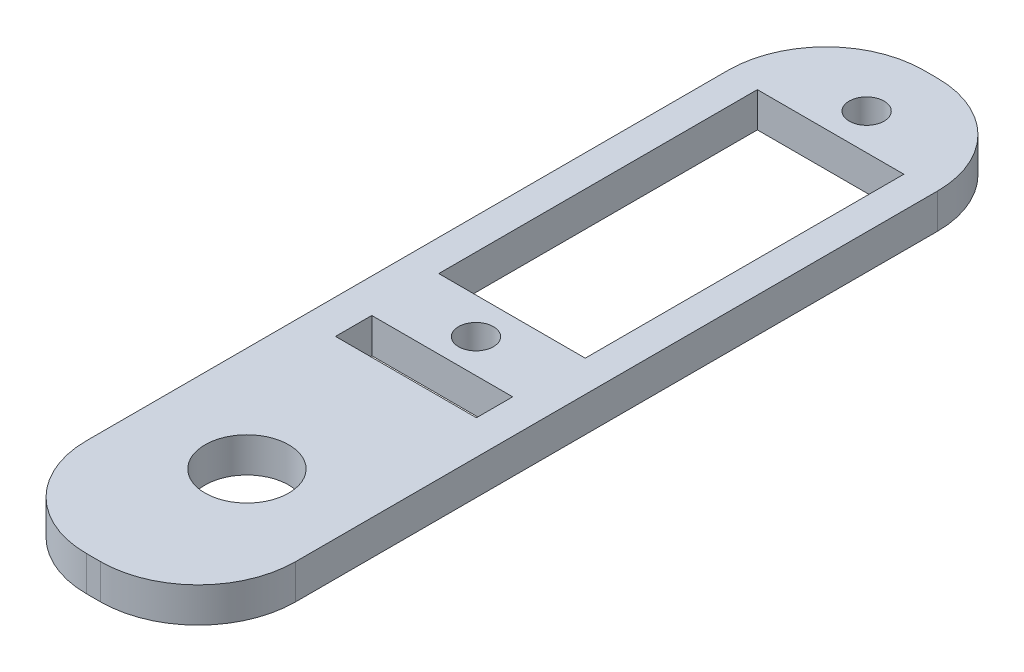
from build123d import *

# Parameters (mm, degrees)
STEM_START                  = 16.223730914
STEM_SERVO_SIDE_OUTLINE_W   = 12.827
STEM_SERVO_SIDE_OUTLINE_H   = 3.302
STEM_SERVO_SIDE_OUTLINE_R   = 1.5875
STEM_SERVO_SIDE_OUTLINE_W_2 = 13.335
STEM_SERVO_SIDE_OUTLINE_H_2 = 29
STEM_SERVO_SIDE_DEPTH       = 3.175
SKETCH1_R                   = 3.81
CUT_EXTRUDE1_DEPTH          = 3.175
FILLET1_R                   = 8.89
FILLET2_R                   = 8.89


# Read off the part's stored shape, not the designer's step: Stem Servo Side
with BuildPart() as part:
    # Stem Servo Side outline → Stem Servo Side (new body)
    with BuildSketch(Plane(origin=(0, 0, 0), x_dir=(1, 0, 0), z_dir=(0, 1, 0)).offset(STEM_START)):
        with BuildLine():
            Line((-2.093063075, 47.682601639), (-3.363063075, 47.682601639))
            ThreePointArc((-3.363063075, 47.682601639), (-9.64924236, 45.078780923), (-12.253063075, 38.792601639))
            Line((-12.253063075, 38.792601639), (-12.253063075, -28.517398361))
            Line((-12.253063075, -28.517398361), (6.796936925, -28.517398361))
            Line((6.796936925, -28.517398361), (6.796936925, 38.792601639))
            ThreePointArc((6.796936925, 38.792601639), (4.19311621, 45.078780924), (-2.093063075, 47.682601639))
        make_face()
        with Locations((-2.728063075, 1.581601639)):
            Rectangle(STEM_SERVO_SIDE_OUTLINE_W, STEM_SERVO_SIDE_OUTLINE_H, mode=Mode.SUBTRACT)
        with Locations((-2.728063075, 6.302601639)):
            Circle(STEM_SERVO_SIDE_OUTLINE_R, mode=Mode.SUBTRACT)
        with Locations((-2.728063075, 24.082601639)):
            Rectangle(STEM_SERVO_SIDE_OUTLINE_W_2, STEM_SERVO_SIDE_OUTLINE_H_2, mode=Mode.SUBTRACT)
        with Locations((-2.728063075, 41.862601639)):
            Circle(STEM_SERVO_SIDE_OUTLINE_R, mode=Mode.SUBTRACT)
    extrude(amount=STEM_SERVO_SIDE_DEPTH)

    # Sketch1 → Cut-Extrude1 (cut)
    with BuildSketch(Plane(origin=(0, 19.398730914, 0), x_dir=(1, 0, 0), z_dir=(0, 1, 0))):
        with Locations(Location((-2.728063075, -14.547398361, 0), (0, 0, 270))):
            Circle(SKETCH1_R)
    extrude(amount=-CUT_EXTRUDE1_DEPTH, mode=Mode.SUBTRACT)

    # Fillet1
    fillet1_edges = [part.edges().sort_by_distance(p)[0] for p in [
        (6.796936925, 17.811230914, 28.517398361),
    ]]
    fillet(fillet1_edges, radius=FILLET1_R)

    # Fillet2
    fillet2_edges = [part.edges().sort_by_distance(p)[0] for p in [
        (-12.253063075, 17.811230914, 28.517398361),
    ]]
    fillet(fillet2_edges, radius=FILLET2_R)


solid = part.part
